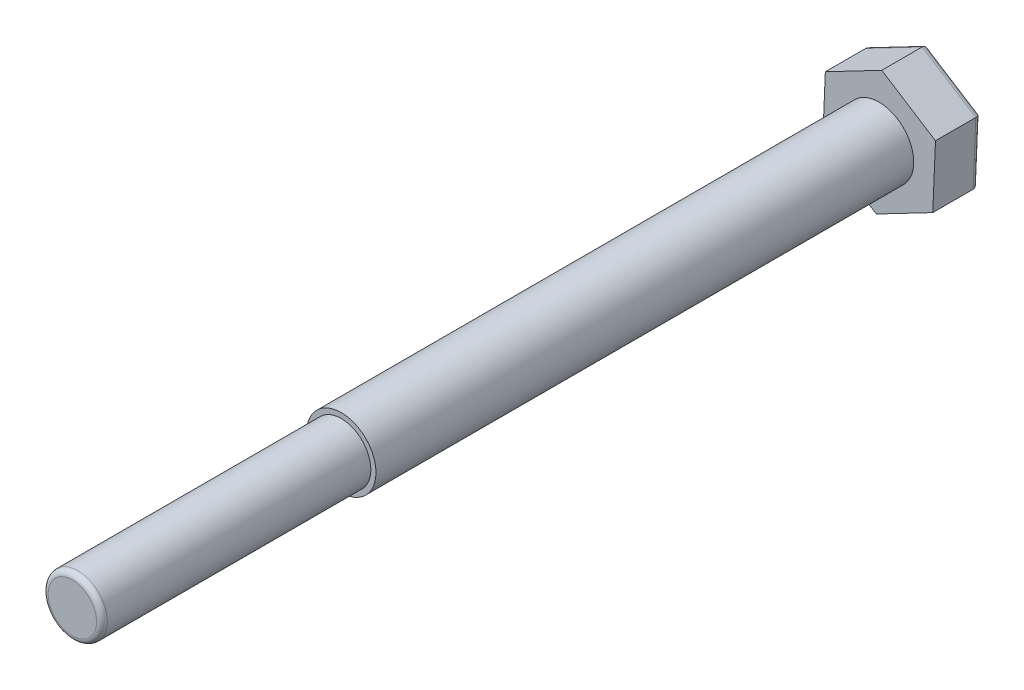
from build123d import *

# Parameters (mm, degrees)
EXTRUDE_306_DEPTH = 17
SKETCH_2_R        = 12.9
EXTRUDE_1_DEPTH   = 200
FILLET_3_R        = 2
SKETCH_3_R        = 11
EXTRUDE_2_DEPTH   = 100
FILLET_4_R        = 2


with BuildPart() as part:
    # 草图1 → Extrude 306 (new body)
    with BuildSketch(Plane.XY):
        Polygon((20.984201837, 10.954296262), (1.005402075, 23.65), (-19.978799762, 12.695703738), (-20.984201837, -10.954296262), (-1.005402075, -23.65), (19.978799762, -12.695703738), align=None)
    extrude(amount=EXTRUDE_306_DEPTH)

    # 草图2 → 凸台-拉伸1 (add)
    with BuildSketch(Plane.XY.offset(17)):
        Circle(SKETCH_2_R)
    extrude(amount=EXTRUDE_1_DEPTH)

    # 圆角3
    fillet_3_edges = [part.edges().sort_by_distance(p)[0] for p in [
        (10.994801956, 17.302148131, 0),
        (-9.486698843, 18.172851869, 0),
        (-20.4815008, 0.870703738, 0),
        (-10.994801956, -17.302148131, 0),
        (9.486698843, -18.172851869, 0),
        (20.4815008, -0.870703738, 0),
    ]]
    fillet(fillet_3_edges, radius=FILLET_3_R)

    # 草图3 → 凸台-拉伸2 (add)
    with BuildSketch(Plane.XY.offset(217)):
        Circle(SKETCH_3_R)
    extrude(amount=EXTRUDE_2_DEPTH)

    # 圆角4
    fillet_4_edges = [part.edges().sort_by_distance(p)[0] for p in [
        (-11, 0, 317),
    ]]
    fillet(fillet_4_edges, radius=FILLET_4_R)


solid = part.part
